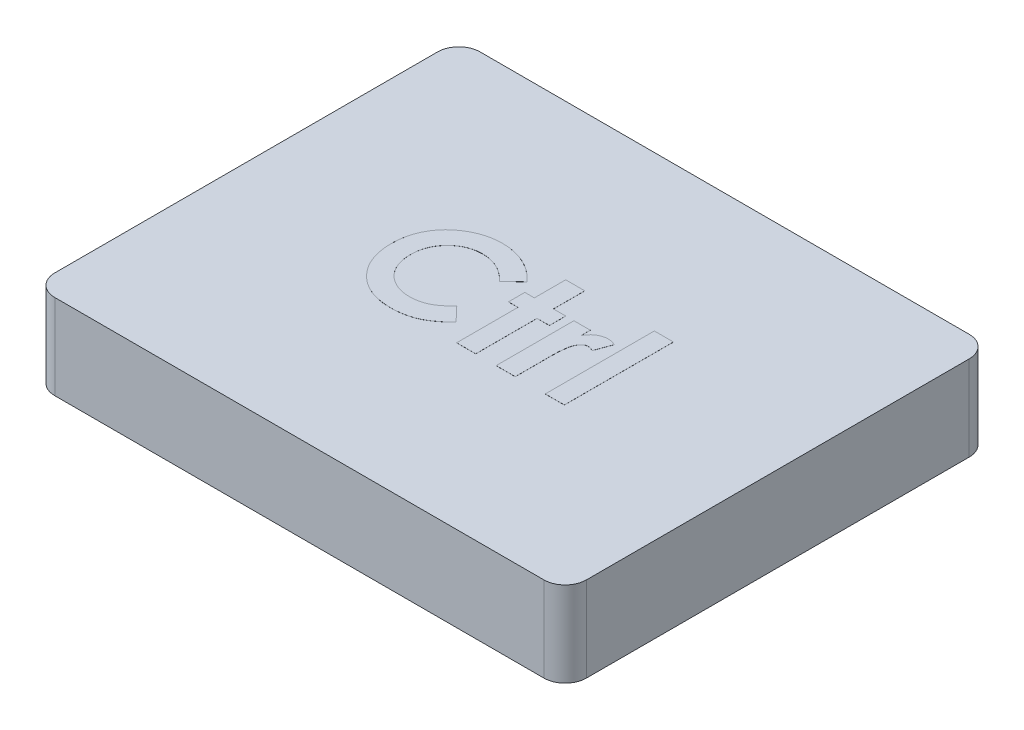
from build123d import *

# Parameters (mm, degrees)
SKETCH1_W           = 15.875
SKETCH1_H           = 12.7
BOSS_EXTRUDE1_DEPTH = 2.54
FILLET1_R           = 0.635
SHELL1_START        = 0.635
SHELL1_OUTLINE_W    = 1.905
SHELL1_OUTLINE_H    = 11.43
SHELL1_DEPTH        = 14.605
SKETCH2_R           = 2.54
BOSS_EXTRUDE2_DEPTH = 1.905
SKETCH3_W           = 0.569871795
SKETCH3_H           = 3.256410256
BOSS_EXTRUDE3_DEPTH = 0.00254


# Read off the part's stored shape, not the designer's step: Shell1
with BuildPart() as part:
    # Sketch1 → Boss-Extrude1 (new body)
    with BuildSketch(Plane(origin=(0, 0, 0), x_dir=(1, 0, 0), z_dir=(0, 1, 0))):
        with Locations((7.9375, 6.35)):
            Rectangle(SKETCH1_W, SKETCH1_H)
    extrude(amount=BOSS_EXTRUDE1_DEPTH)

    # Fillet1
    fillet1_edges = [part.edges().sort_by_distance(p)[0] for p in [
        (0, 1.27, -12.7),
        (15.875, 1.27, -12.7),
        (15.875, 1.27, 0),
        (0, 1.27, 0),
    ]]
    fillet(fillet1_edges, radius=FILLET1_R)

    # Shell1 outline → Shell1 (cut)
    with BuildSketch(Plane.YZ.offset(SHELL1_START)):
        with Locations((0.9525, -6.35)):
            Rectangle(SHELL1_OUTLINE_W, SHELL1_OUTLINE_H)
    extrude(amount=SHELL1_DEPTH, mode=Mode.SUBTRACT)

    # Sketch2 → Boss-Extrude2 (add)
    with BuildSketch(Plane(origin=(0, 1.905, 0), x_dir=(-1, 0, 0), z_dir=(0, -1, 0))):
        with Locations(Location((-7.9375, 6.35, 0), (0, 0, 270))):
            Circle(SKETCH2_R)
    extrude(amount=BOSS_EXTRUDE2_DEPTH)

    # Sketch3 → Boss-Extrude3 (add)
    with BuildSketch(Plane(origin=(0, 2.54, 0), x_dir=(1, 0, 0), z_dir=(0, 1, 0))):
        with BuildLine():
            Line((7.279705128, 7.450208734), (6.861841546, 7.050789663))
            add(Edge.make_bspline(
                [(6.861841546, 7.050789663), (6.826394953, 7.0874415), (6.757156652, 7.15903402), (6.645587691, 7.253816208), (6.529560035, 7.332804336), (6.411330769, 7.399327635), (6.288773291, 7.449657252), (6.163304701, 7.486333291), (6.034123843, 7.508693286), (5.946699207, 7.511251666), (5.902726963, 7.512538462)],
                knots=[0, 0, 0, 0, 1.115251505, 2.178435587, 3.19620269, 4.182487026, 5.141301733, 6.088180966, 7.038406374, 8, 8, 8, 8], degree=3))
            add(Edge.make_bspline(
                [(5.902726963, 7.512538462), (5.866004796, 7.511521848), (5.793537645, 7.509515672), (5.687136877, 7.494808428), (5.585359044, 7.469798119), (5.487855743, 7.435329281), (5.394913883, 7.390728433), (5.3063386, 7.336030097), (5.222348271, 7.271728275), (5.144052361, 7.198155668), (5.072430014, 7.117772066), (5.00914711, 7.032002955), (4.956137527, 6.941044826), (4.912633425, 6.845818837), (4.87874541, 6.745884235), (4.854545111, 6.6413083), (4.840548304, 6.531966489), (4.838459187, 6.457636741), (4.837397436, 6.419860176)],
                knots=[0, 0, 0, 0, 1.035432265, 2.043311493, 3.022114605, 3.98653278, 4.95457646, 5.923598177, 6.917315552, 7.932509744, 8.948865224, 9.949768934, 10.933144597, 11.912367597, 12.897413939, 13.903909035, 14.934704909, 16, 16, 16, 16], degree=3))
            add(Edge.make_bspline(
                [(4.837397436, 6.419860176), (4.83770342, 6.39334594), (4.838306522, 6.341085836), (4.844908537, 6.263778637), (4.855539337, 6.188772378), (4.870924739, 6.116180674), (4.890164335, 6.045940615), (4.912736762, 5.977446244), (4.941053539, 5.911643999), (4.97248559, 5.847769629), (5.009040702, 5.787566028), (5.048453857, 5.730156898), (5.091190988, 5.675823652), (5.137528908, 5.624788408), (5.188119763, 5.577848731), (5.241655968, 5.533593089), (5.299040605, 5.493129351), (5.359081648, 5.455442035), (5.422297778, 5.422702743), (5.486973793, 5.39304727), (5.554090313, 5.368962616), (5.622830153, 5.349548188), (5.692947662, 5.333039117), (5.765128654, 5.322873974), (5.83874741, 5.315176031), (5.888501332, 5.314700728), (5.913539263, 5.314461538)],
                knots=[0, 0, 0, 0, 1.103660481, 2.175337485, 3.227646561, 4.255952547, 5.262355991, 6.258840057, 7.255597736, 8.242457506, 9.22035537, 10.185017736, 11.140346927, 12.096287581, 13.051739095, 14.01125915, 14.986044842, 15.97314143, 16.960198552, 17.947847494, 18.933482797, 19.925264591, 20.920966487, 21.929612487, 22.958107872, 24, 24, 24, 24], degree=3))
            add(Edge.make_bspline(
                [(5.913539263, 5.314461538), (5.956007897, 5.315689957), (6.039447719, 5.318103479), (6.161907656, 5.336976883), (6.278599775, 5.368022564), (6.37183622, 5.40468571), (6.444884512, 5.440891042), (6.500495097, 5.474379191), (6.558000776, 5.511839363), (6.616446429, 5.554685345), (6.676489454, 5.602402968), (6.737069952, 5.656037337), (6.799738796, 5.713822348), (6.840792535, 5.755064647), (6.861841546, 5.776210337)],
                knots=[0, 0, 0, 0, 1.404581149, 2.759636711, 4.088442092, 5.392261763, 6.066678138, 6.783632037, 7.538459478, 8.336747902, 9.180226004, 10.074962426, 11.012997595, 12, 12, 12, 12], degree=3))
            Line((6.861841546, 5.776210337), (7.266984776, 5.350714543))
            add(Edge.make_bspline(
                [(7.266984776, 5.350714543), (7.238505387, 5.323218588), (7.182919712, 5.269552363), (7.099070264, 5.193351332), (7.015326343, 5.124876235), (6.933711029, 5.061641725), (6.852887378, 5.005489979), (6.77286396, 4.956364915), (6.694546676, 4.91302409), (6.616309243, 4.876198427), (6.537664826, 4.844929614), (6.456748963, 4.818009219), (6.373314287, 4.795235533), (6.286851216, 4.776860159), (6.198166225, 4.76212559), (6.106429341, 4.752179841), (6.012222221, 4.745493645), (5.948320072, 4.744892834), (5.916083333, 4.744589744)],
                knots=[0, 0, 0, 0, 1.244526981, 2.429050516, 3.560637417, 4.644440555, 5.67424972, 6.652764056, 7.595344123, 8.486817594, 9.369275933, 10.254498637, 11.166417451, 12.086725134, 13.032340136, 13.991389299, 14.986715468, 16, 16, 16, 16], degree=3))
            add(Edge.make_bspline(
                [(5.916083333, 4.744589744), (5.856868437, 4.746099249), (5.741001344, 4.749052933), (5.57120114, 4.770937726), (5.409895505, 4.807627196), (5.256692012, 4.859516227), (5.111639375, 4.925802032), (4.974774704, 5.007065316), (4.846318595, 5.103090176), (4.727308719, 5.212751107), (4.619658622, 5.333862399), (4.524508403, 5.463902701), (4.445800139, 5.603511114), (4.380446971, 5.750625175), (4.329341653, 5.905916222), (4.293372173, 6.069552234), (4.271190057, 6.24137521), (4.268763302, 6.358734263), (4.267525641, 6.418588141)],
                knots=[0, 0, 0, 0, 1.078019885, 2.10938526, 3.111377082, 4.085535484, 5.04941344, 6.010039228, 6.978205633, 7.964457913, 8.951525778, 9.924444315, 10.892603023, 11.863865945, 12.85144698, 13.863884204, 14.910567087, 16, 16, 16, 16], degree=3))
            add(Edge.make_bspline(
                [(4.267525641, 6.418588141), (4.268048616, 6.45762433), (4.269085026, 6.534984515), (4.279977786, 6.648942336), (4.295162928, 6.760030827), (4.319252774, 6.867096523), (4.348290707, 6.971581794), (4.384403193, 7.072351009), (4.427532553, 7.169693788), (4.476288628, 7.263773089), (4.531445888, 7.353972592), (4.593062603, 7.43951734), (4.659552517, 7.521067724), (4.732513276, 7.597541827), (4.810884664, 7.669611105), (4.895020519, 7.736885002), (4.984414805, 7.800328301), (5.07930948, 7.858304953), (5.177860994, 7.910747916), (5.278826351, 7.95700485), (5.381957492, 7.995664994), (5.486818369, 8.027732158), (5.593852019, 8.051668028), (5.702294461, 8.06978671), (5.813068412, 8.079915169), (5.887443523, 8.081573262), (5.92498758, 8.082410256)],
                knots=[0, 0, 0, 0, 1.071919942, 2.124283339, 3.142214191, 4.149696895, 5.136002878, 6.119640489, 7.086990633, 8.058538607, 9.028339693, 9.988281803, 10.952401235, 11.916291999, 12.888973767, 13.874849856, 14.873389453, 15.898127285, 16.927174885, 17.938320013, 18.946391617, 19.950418109, 20.947802303, 21.956882652, 22.968648068, 24, 24, 24, 24], degree=3))
            add(Edge.make_bspline(
                [(5.92498758, 8.082410256), (5.95701651, 8.08193047), (6.020741359, 8.080975887), (6.115638353, 8.073018393), (6.209776405, 8.060521229), (6.302818472, 8.041665671), (6.395430086, 8.01928174), (6.486394226, 7.98997307), (6.577145903, 7.957303034), (6.666261809, 7.918252678), (6.753866337, 7.875625686), (6.837907215, 7.827263816), (6.91979548, 7.776143202), (6.997716537, 7.719238304), (7.073130016, 7.658613168), (7.145641572, 7.593984943), (7.214614876, 7.524276087), (7.257898691, 7.475022665), (7.279705128, 7.450208734)],
                knots=[0, 0, 0, 0, 0.996412454, 1.982464992, 2.961075852, 3.949442424, 4.934965278, 5.923860011, 6.921385422, 7.934793307, 8.949617135, 9.951082467, 10.950285876, 11.951772932, 12.951063433, 13.960125323, 14.972308753, 16, 16, 16, 16], degree=3))
        make_face()
        Polygon((7.808871795, 8.082410256), (8.37874359, 8.082410256), (8.37874359, 7.146192308), (8.745089744, 7.146192308), (8.745089744, 6.657730769), (8.37874359, 6.657730769), (8.37874359, 4.826), (7.808871795, 4.826), (7.808871795, 6.657730769), (7.523935897, 6.657730769), (7.523935897, 7.146192308), (7.808871795, 7.146192308), align=None)
        with BuildLine():
            Line((8.989320513, 7.146192308), (9.477782051, 7.146192308))
            Line((9.477782051, 7.146192308), (9.477782051, 6.860620393))
            add(Edge.make_bspline(
                [(9.477782051, 6.860620393), (9.49159969, 6.885999247), (9.51860684, 6.935603272), (9.568221237, 7.002186851), (9.625220267, 7.058261684), (9.687555778, 7.105000626), (9.755416695, 7.141429043), (9.826985825, 7.167388882), (9.901650896, 7.18425918), (9.952584876, 7.186011685), (9.978327925, 7.186897436)],
                knots=[0, 0, 0, 0, 1.09866127, 2.147379032, 3.14564304, 4.131443017, 5.102343063, 6.064490016, 7.021754664, 8, 8, 8, 8], degree=3))
            add(Edge.make_bspline(
                [(9.978327925, 7.186897436), (9.99702059, 7.186022129), (10.035085533, 7.184239691), (10.093101861, 7.173878355), (10.151955263, 7.155143087), (10.190685873, 7.138274469), (10.210474359, 7.129655849)],
                knots=[0, 0, 0, 0, 0.931404136, 1.896671404, 2.925354185, 4, 4, 4, 4], degree=3))
            Line((10.210474359, 7.129655849), (10.033661458, 6.64691847))
            add(Edge.make_bspline(
                [(10.033661458, 6.64691847), (10.01785691, 6.654554463), (9.988150443, 6.668907192), (9.945021811, 6.68584489), (9.905880789, 6.696179446), (9.8810661, 6.697721452), (9.86956891, 6.698435897)],
                knots=[0, 0, 0, 0, 1.214386998, 2.282580073, 3.20428172, 4, 4, 4, 4], degree=3))
            add(Edge.make_bspline(
                [(9.86956891, 6.698435897), (9.858713328, 6.697962468), (9.837358527, 6.697031151), (9.805839437, 6.689050083), (9.776155019, 6.675286977), (9.746874781, 6.657655073), (9.720308609, 6.633145407), (9.693758846, 6.604771118), (9.670361774, 6.569739283), (9.645671077, 6.530747072), (9.624647831, 6.483020641), (9.606621046, 6.426045117), (9.590559035, 6.359161255), (9.579506178, 6.282013934), (9.568823149, 6.195349687), (9.562464348, 6.098532411), (9.557725052, 5.991868249), (9.557435276, 5.917412815), (9.557284255, 5.878609175)],
                knots=[0, 0, 0, 0, 0.544232178, 1.070598461, 1.618251235, 2.182094276, 2.777567932, 3.425210017, 4.127676488, 4.886675562, 5.738955394, 6.734782583, 7.883056018, 9.186093582, 10.642914445, 12.264202625, 14.053029461, 16, 16, 16, 16], degree=3))
            Line((9.557284255, 5.878609175), (9.559192308, 5.765398037))
            Line((9.559192308, 5.765398037), (9.559192308, 4.826))
            Line((9.559192308, 4.826), (8.989320513, 4.826))
            Line((8.989320513, 4.826), (8.989320513, 7.146192308))
        make_face()
        with Locations((10.739641026, 6.454205128)):
            Rectangle(SKETCH3_W, SKETCH3_H)
    extrude(amount=BOSS_EXTRUDE3_DEPTH)


solid = part.part
